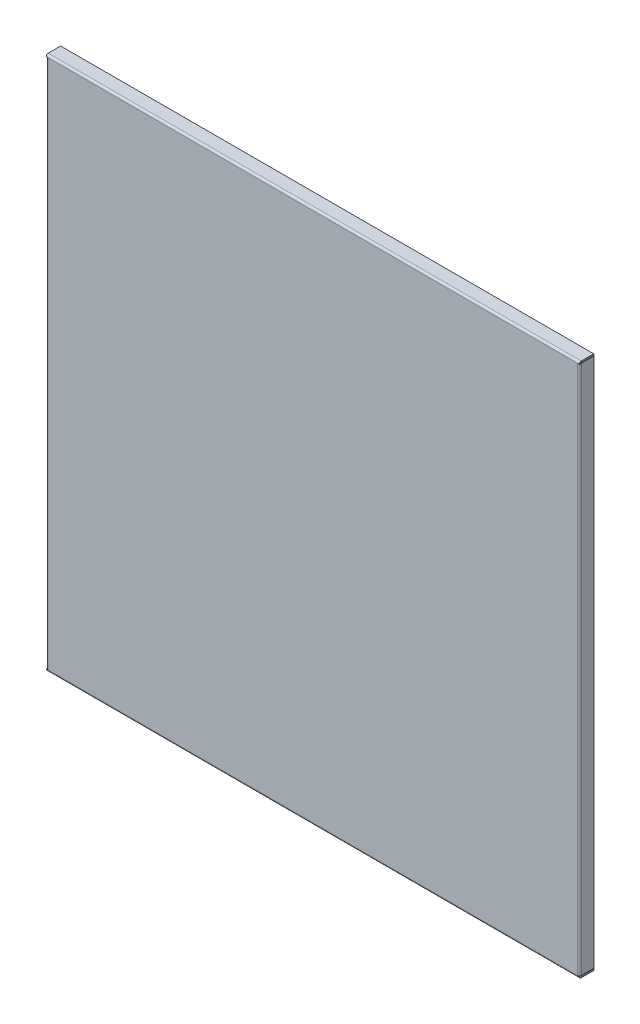
from build123d import *

# Parameters (mm, degrees)
SKETCH_2_W                         = 555
SKETCH_2_H                         = 556
SM_BASE_FLANGE_1_DEPTH             = 1.5
SM_EDGE_FLANGE_2_STRIP_W           = 7
SM_EDGE_FLANGE_2_STRIP_H           = 1.5
SM_EDGE_FLANGE_2_STRIP_CUT_DEPTH   = 555
SM_EDGE_FLANGE_2_STRIP_2_W         = 7
SM_EDGE_FLANGE_2_STRIP_2_H         = 1.5
SM_EDGE_FLANGE_2_STRIP_CUT_2_DEPTH = 555
SM_EDGE_FLANGE_2_DEPTH             = 555
SM_EDGE_FLANGE_2_BEND_DEPTH        = 555
SM_EDGE_FLANGE_3_STRIP_W           = 7
SM_EDGE_FLANGE_3_STRIP_H           = 1.5
SM_EDGE_FLANGE_3_STRIP_CUT_DEPTH   = 552
SM_EDGE_FLANGE_3_STRIP_2_W         = 7
SM_EDGE_FLANGE_3_STRIP_2_H         = 1.5
SM_EDGE_FLANGE_3_STRIP_CUT_2_DEPTH = 552
SM_EDGE_FLANGE_3_DEPTH             = 552
SM_EDGE_FLANGE_3_BEND_DEPTH        = 552


# Sheet-metal steps are written as plain solids
with BuildPart() as part:
    # Sketch 2 → 基体-法兰1 (new body)
    with BuildSketch(Plane.XY):
        Rectangle(SKETCH_2_W, SKETCH_2_H)
    extrude(amount=-SM_BASE_FLANGE_1_DEPTH)

    # 边线-法兰2 strip (across the edge) → 边线-法兰2 strip cut (cut)
    with BuildSketch(Plane(origin=(-277.5, 278, -1.5), x_dir=(0, -1, 0), z_dir=(1, 0, 0))):
        with Locations((-1.5, -0.75)):
            Rectangle(SM_EDGE_FLANGE_2_STRIP_W, SM_EDGE_FLANGE_2_STRIP_H)
    extrude(amount=SM_EDGE_FLANGE_2_STRIP_CUT_DEPTH, mode=Mode.SUBTRACT)

    # 边线-法兰2 strip 2 (across the edge) → 边线-法兰2 strip cut 2 (cut)
    with BuildSketch(Plane(origin=(277.5, -278, -1.5), x_dir=(0, 1, 0), z_dir=(-1, 0, 0))):
        with Locations((-1.5, -0.75)):
            Rectangle(SM_EDGE_FLANGE_2_STRIP_2_W, SM_EDGE_FLANGE_2_STRIP_2_H)
    extrude(amount=SM_EDGE_FLANGE_2_STRIP_CUT_2_DEPTH, mode=Mode.SUBTRACT)

    # 边线-法兰2 section (across the edge) → 边线-法兰2 (add)
    with BuildSketch(Plane(origin=(-277.5, 278, -1.5), x_dir=(0, -1, 0), z_dir=(1, 0, 0))):
        with BuildLine():
            Line((0, 0.5), (0, 13.5))
            Line((0, 13.5), (1.5, 13.5))
            Line((1.5, 13.5), (1.5, 0.5))
            ThreePointArc((1.5, 0.5), (1.646446609, 0.146446609), (2, 0))
            Line((2, 0), (2, -1.5))
            ThreePointArc((2, -1.5), (0.585786438, -0.914213562), (0, 0.5))
        make_face()
    extrude(amount=SM_EDGE_FLANGE_2_DEPTH)

    # 边线-法兰2 section 2 (across the edge) → 边线-法兰2 bend (add)
    with BuildSketch(Plane(origin=(277.5, -278, -1.5), x_dir=(0, 1, 0), z_dir=(-1, 0, 0))):
        with BuildLine():
            Line((0, 0.5), (0, 13.5))
            Line((0, 13.5), (1.5, 13.5))
            Line((1.5, 13.5), (1.5, 0.5))
            ThreePointArc((1.5, 0.5), (1.646446609, 0.146446609), (2, 0))
            Line((2, 0), (2, -1.5))
            ThreePointArc((2, -1.5), (0.585786438, -0.914213562), (0, 0.5))
        make_face()
    extrude(amount=SM_EDGE_FLANGE_2_BEND_DEPTH)

    # 边线-法兰3 strip (across the edge) → 边线-法兰3 strip cut (cut)
    with BuildSketch(Plane(origin=(-277.5, -276, -1.5), x_dir=(1, 0, 0), z_dir=(0, 1, 0))):
        with Locations((-1.5, -0.75)):
            Rectangle(SM_EDGE_FLANGE_3_STRIP_W, SM_EDGE_FLANGE_3_STRIP_H)
    extrude(amount=SM_EDGE_FLANGE_3_STRIP_CUT_DEPTH, mode=Mode.SUBTRACT)

    # 边线-法兰3 strip 2 (across the edge) → 边线-法兰3 strip cut 2 (cut)
    with BuildSketch(Plane(origin=(277.5, 276, -1.5), x_dir=(-1, 0, 0), z_dir=(0, -1, 0))):
        with Locations((-1.5, -0.75)):
            Rectangle(SM_EDGE_FLANGE_3_STRIP_2_W, SM_EDGE_FLANGE_3_STRIP_2_H)
    extrude(amount=SM_EDGE_FLANGE_3_STRIP_CUT_2_DEPTH, mode=Mode.SUBTRACT)

    # 边线-法兰3 section (across the edge) → 边线-法兰3 (add)
    with BuildSketch(Plane(origin=(-277.5, -276, -1.5), x_dir=(1, 0, 0), z_dir=(0, 1, 0))):
        with BuildLine():
            Line((0, 0.5), (0, 13.5))
            Line((0, 13.5), (1.5, 13.5))
            Line((1.5, 13.5), (1.5, 0.5))
            ThreePointArc((1.5, 0.5), (1.646446609, 0.146446609), (2, 0))
            Line((2, 0), (2, -1.5))
            ThreePointArc((2, -1.5), (0.585786438, -0.914213562), (0, 0.5))
        make_face()
    extrude(amount=SM_EDGE_FLANGE_3_DEPTH)

    # 边线-法兰3 section 2 (across the edge) → 边线-法兰3 bend (add)
    with BuildSketch(Plane(origin=(277.5, 276, -1.5), x_dir=(-1, 0, 0), z_dir=(0, -1, 0))):
        with BuildLine():
            Line((0, 0.5), (0, 13.5))
            Line((0, 13.5), (1.5, 13.5))
            Line((1.5, 13.5), (1.5, 0.5))
            ThreePointArc((1.5, 0.5), (1.646446609, 0.146446609), (2, 0))
            Line((2, 0), (2, -1.5))
            ThreePointArc((2, -1.5), (0.585786438, -0.914213562), (0, 0.5))
        make_face()
    extrude(amount=SM_EDGE_FLANGE_3_BEND_DEPTH)


solid = part.part
